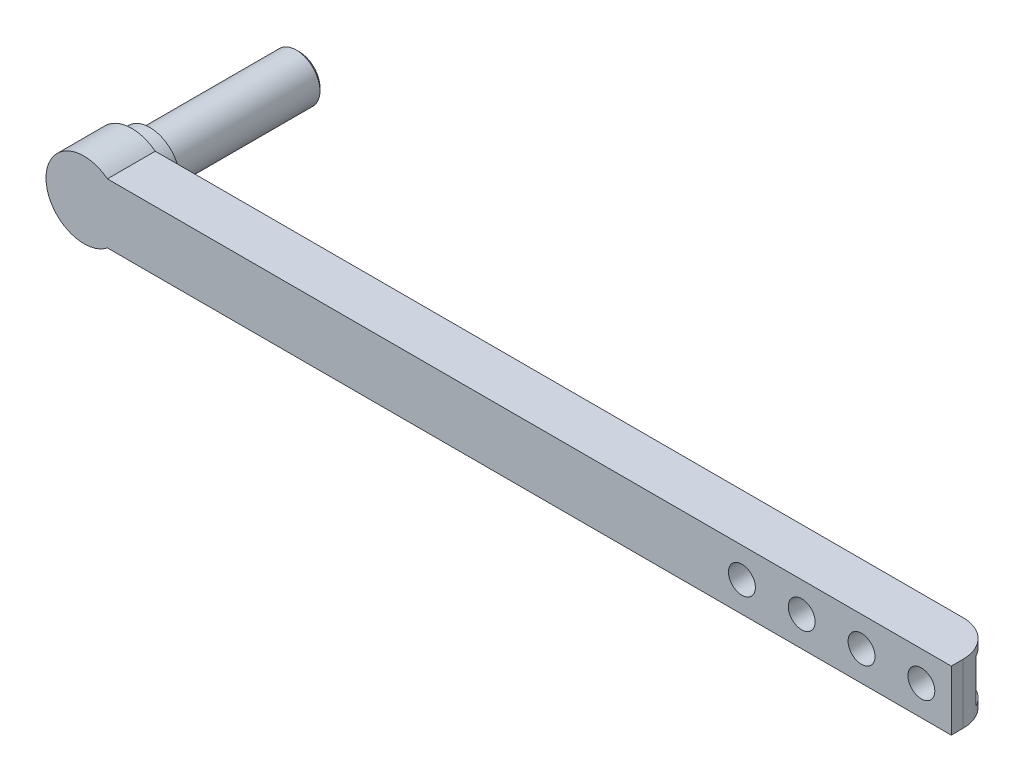
from build123d import *

# Parameters (mm, degrees)
SKETCH1_R            = 3.95
BOSS_EXTRUDE1_DEPTH  = 28
BOSS_EXTRUDE2_START  = 8
BOSS_EXTRUDE2_DEPTH  = 8
SKETCH3_R            = 5
BOSS_EXTRUDE3_DEPTH  = 3
SKETCH5_W            = 3.2
SKETCH5_H            = 7.25
CUT_EXTRUDE1_DEPTH   = 42
M4_CLEARANCE_HOLE1_D = 4.5
CHAMFER1_SIZE        = 0.5
FILLET1_R            = 3.7
FILLET5_R            = 6


with BuildPart() as part:
    # Sketch1 → Boss-Extrude1 (new body)
    with BuildSketch(Plane.XY):
        Circle(SKETCH1_R)
    extrude(amount=-BOSS_EXTRUDE1_DEPTH)

    # Sketch2 → Boss-Extrude2 (add)
    with BuildSketch(Plane.XY.offset(BOSS_EXTRUDE2_START)):
        with BuildLine():
            ThreePointArc((6.35, 0), (5.708717799, 2.780834604), (3.914396505, 5))
            Line((3.914396505, 5), (0, 5))
            Line((0, 5), (0, 3.95))
            ThreePointArc((0, 3.95), (2.793071786, 2.793071786), (3.95, 0))
            ThreePointArc((3.95, 0), (2.793071786, -2.793071786), (0, -3.95))
            Line((0, -3.95), (0, -5))
            Line((0, -5), (3.914396505, -5))
            ThreePointArc((3.914396505, -5), (5.708717799, -2.780834604), (6.35, 0))
        make_face()
        with BuildLine():
            Line((0, 5), (3.914396505, 5))
            ThreePointArc((3.914396505, 5), (-6.35, 0), (3.914396505, -5))
            Line((3.914396505, -5), (0, -5))
            Line((0, -5), (0, -3.95))
            ThreePointArc((0, -3.95), (-3.95, 0), (0, 3.95))
            Line((0, 3.95), (0, 5))
        make_face()
        with BuildLine():
            Line((145, -5), (145, 5))
            Line((145, 5), (3.914396505, 5))
            ThreePointArc((3.914396505, 5), (5.708717799, 2.780834604), (6.35, 0))
            ThreePointArc((6.35, 0), (5.708717799, -2.780834604), (3.914396505, -5))
            Line((3.914396505, -5), (145, -5))
        make_face()
        with BuildLine():
            ThreePointArc((3.95, 0), (2.793071786, 2.793071786), (0, 3.95))
            Line((0, 3.95), (0, -3.95))
            ThreePointArc((0, -3.95), (2.793071786, -2.793071786), (3.95, 0))
        make_face()
        with BuildLine():
            Line((0, -3.95), (0, 3.95))
            ThreePointArc((0, 3.95), (-3.95, 0), (0, -3.95))
        make_face()
    extrude(amount=-BOSS_EXTRUDE2_DEPTH)

    # Sketch3 → Boss-Extrude3 (add)
    with BuildSketch(Plane.XY):
        Circle(SKETCH3_R)
    extrude(amount=-BOSS_EXTRUDE3_DEPTH)

    # Sketch5 → Cut-Extrude1 (cut)
    with BuildSketch(Plane(origin=(145, 0, 0), x_dir=(0, 0, -1), z_dir=(1, 0, 0))):
        with Locations((-1.6, 0)):
            Rectangle(SKETCH5_W, SKETCH5_H)
    extrude(amount=-CUT_EXTRUDE1_DEPTH, mode=Mode.SUBTRACT)

    # M4 Clearance Hole1 (through all)
    with Locations(Plane.XY.offset(8)):
        with Locations((140, 0), (130, 0), (120, 0), (110, 0)):
            Hole(M4_CLEARANCE_HOLE1_D / 2)

    # Chamfer1
    chamfer1_edges = [part.edges().sort_by_distance(p)[0] for p in [
        (-3.95, 0, -28),
    ]]
    chamfer(chamfer1_edges, length=CHAMFER1_SIZE)

    # Fillet1
    # the kernel refuses this fillet: 3.7 mm, written as the material it adds along each edge
    with BuildSketch(Plane(origin=(103, -3.625, 3.2), x_dir=(0, 1, 0), z_dir=(0, 0, -1))) as fillet1_piece_1:
        with BuildLine():
            CenterArc((FILLET1_R, FILLET1_R), FILLET1_R, 180, 90)
            Line((0, FILLET1_R), (0, 0))
            Line((0, 0), (FILLET1_R, 0))
        make_face()
    extrude(amount=3.2)
    with BuildSketch(Plane(origin=(103, 3.625, 0), x_dir=(1, 0, 0), z_dir=(0, 0, 1))) as fillet1_piece_2:
        with BuildLine():
            CenterArc((FILLET1_R, -FILLET1_R), FILLET1_R, 90, 90)
            Line((0, -FILLET1_R), (0, 0))
            Line((0, 0), (FILLET1_R, 0))
        make_face()
    extrude(amount=3.2)

    # Fillet5
    fillet5_edges = [part.edges().sort_by_distance(p)[0] for p in [
        (145, 4.3125, 0),
    ]]
    fillet(fillet5_edges, radius=FILLET5_R)


solid = part.part
